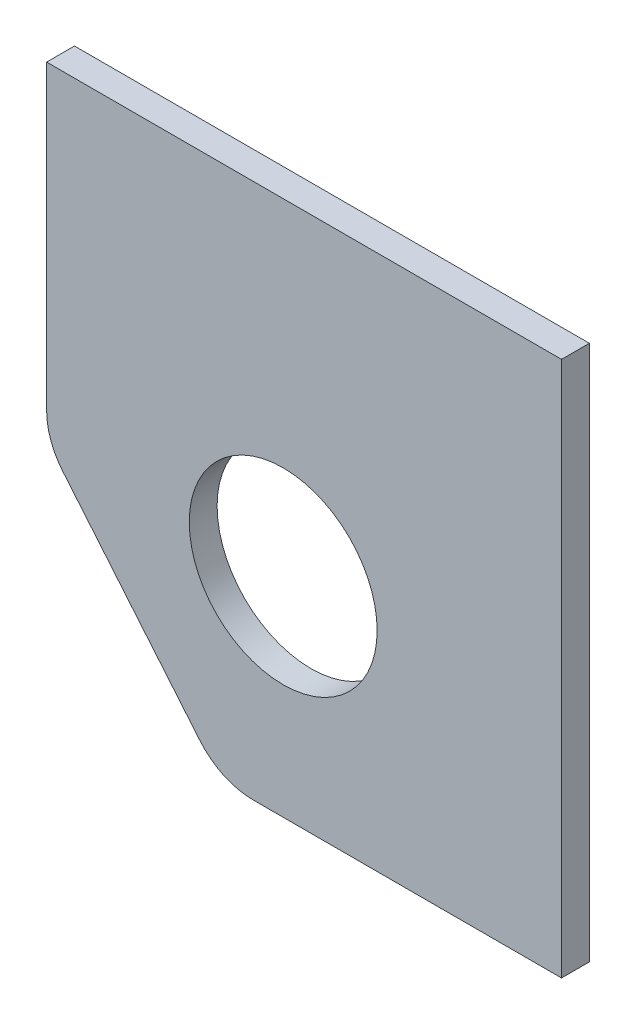
from build123d import *

# Parameters (mm, degrees)
ESBO_O1_W                  = 74
ESBO_O1_H                  = 77
RESSALTO_EXTRUS_O1_DEPTH   = 4
CORTE_EXTRUS_O1_DEPTH      = 4
CORTE_EXTRUS_O1_DEPTH_BACK = 4
ESBO_O2_R                  = 13.5
CORTE_EXTRUS_O2_DEPTH      = 97.844420883
CORTE_EXTRUS_O2_DEPTH_BACK = 97.844420883
FILETE2_R                  = 10
FILETE3_R                  = 10


with BuildPart() as part:
    # Esboço1 → Ressalto-extrusão1 (new body)
    with BuildSketch(Plane.XY):
        with Locations((-49.165685596, 5.526315789)):
            Rectangle(ESBO_O1_W, ESBO_O1_H)
    extrude(amount=RESSALTO_EXTRUS_O1_DEPTH)

    # Esboço2 → Corte-extrusão1 (cut, two sides: drawn at the far end of the back side and taken through both)
    with BuildSketch(Plane.XY.offset(4).offset(-CORTE_EXTRUS_O1_DEPTH_BACK)):
        with Locations((-52.165685596, -2.973684211)):
            Circle(ESBO_O2_R)
    extrude(amount=CORTE_EXTRUS_O1_DEPTH + CORTE_EXTRUS_O1_DEPTH_BACK, mode=Mode.SUBTRACT)

    # Esboço4 → Corte-extrusão2 (cut, two sides: drawn at the far end of the back side and taken through both)
    with BuildSketch(Plane.XY.offset(4).offset(-CORTE_EXTRUS_O2_DEPTH_BACK)):
        Polygon((62.093925387, -180.88521739), (-61.165685596, -32.973684211), (-86.165685596, -2.973684211), (-209.425296578, 144.937848968), (-505.248362936, -101.581372997), (-233.729140971, -427.404439354), align=None)
    extrude(amount=CORTE_EXTRUS_O2_DEPTH + CORTE_EXTRUS_O2_DEPTH_BACK, mode=Mode.SUBTRACT)

    # Filete2
    filete2_edges = [part.edges().sort_by_distance(p)[0] for p in [
        (-86.165685596, -2.973684211, 2),
    ]]
    fillet(filete2_edges, radius=FILETE2_R)

    # Filete3
    filete3_edges = [part.edges().sort_by_distance(p)[0] for p in [
        (-61.165685596, -32.973684211, 2),
    ]]
    fillet(filete3_edges, radius=FILETE3_R)


solid = part.part
